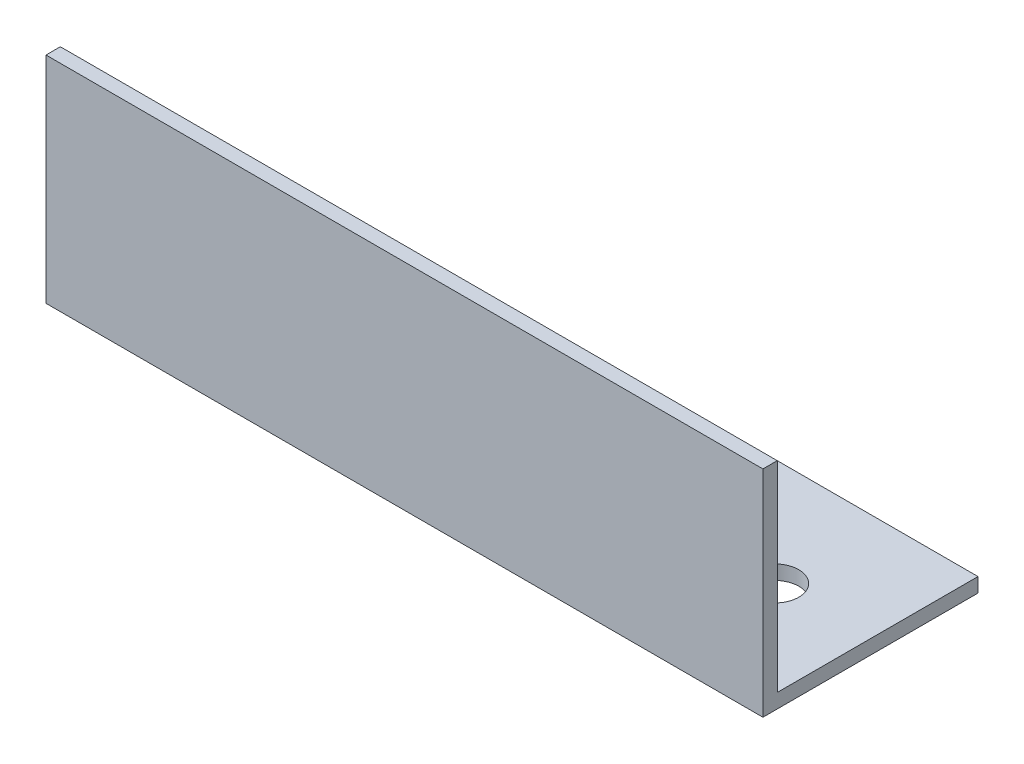
from build123d import *

# Parameters (mm, degrees)
EXTRUDE_1_DEPTH     = 150
SKETCH_2_R          = 5
CUT_EXTRUDE_1_DEPTH = 163.941707368


with BuildPart() as part:
    # Эскиз1 → Вытянуть-Тонкостенный1 (new body)
    with BuildSketch(Plane(origin=(0, 0, 0), x_dir=(0, 0, -1), z_dir=(1, 0, 0))):
        Polygon((45, 0), (0, 0), (0, 45), (3, 45), (3, 3), (45, 3), align=None)
    extrude(amount=EXTRUDE_1_DEPTH)

    # Эскиз2 → Вырез-Вытянуть1 (cut, through all)
    with BuildSketch(Plane.XZ):
        with Locations((30, -22.5)):
            Circle(SKETCH_2_R)
        with Locations((130, -22.5)):
            Circle(SKETCH_2_R)
    extrude(amount=-CUT_EXTRUDE_1_DEPTH, mode=Mode.SUBTRACT)


solid = part.part
